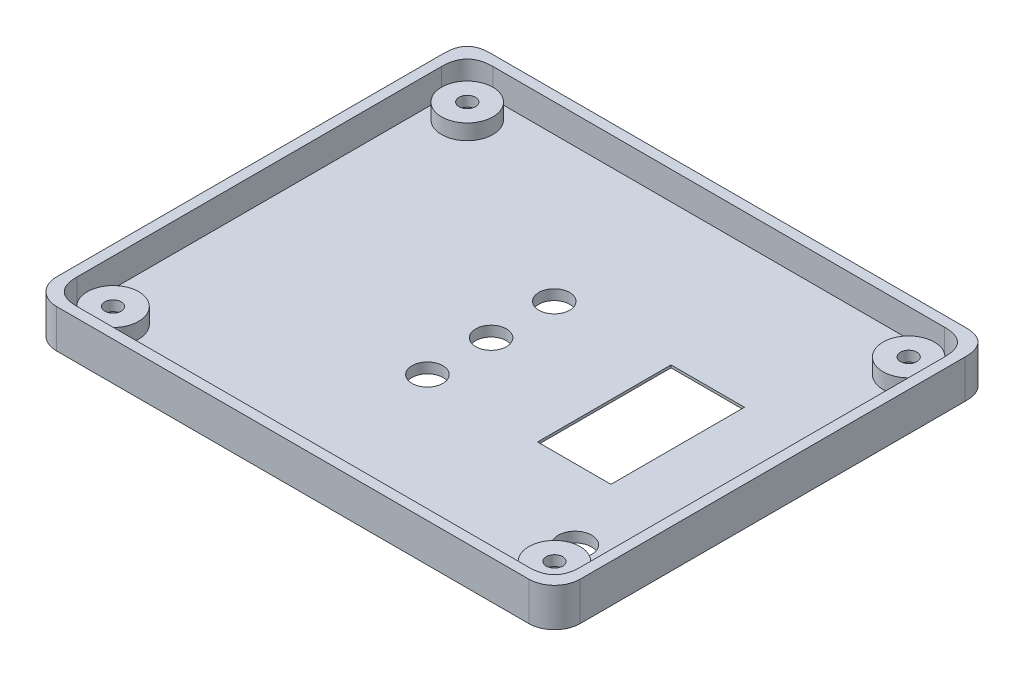
from build123d import *

# Parameters (mm, degrees)
SKETCH1_W           = 102
SKETCH1_H           = 85
BOSS_EXTRUDE1_DEPTH = 7.5
SKETCH2_W           = 98
SKETCH2_H           = 81
CUT_EXTRUDE1_DEPTH  = 5.5
SKETCH3_R           = 5
BOSS_EXTRUDE2_DEPTH = 4
SKETCH3_3_R         = 5
BOSS_EXTRUDE3_DEPTH = 5
SKETCH4_R           = 3
CUT_EXTRUDE3_DEPTH  = 3
SKETCH5_R           = 1.6
CUT_EXTRUDE4_DEPTH  = 7.5
SKETCH6_W           = 14.3
SKETCH6_H           = 26
CUT_EXTRUDE5_DEPTH  = 10
CHAMFER1_SIZE       = 1.5
CHAMFER2_SIZE       = 1.5
CHAMFER3_SIZE       = 1.5
CHAMFER4_SIZE       = 1.5
SKETCH7_R           = 3.25
CUT_EXTRUDE6_DEPTH  = 10
FILLET2_R           = 5
FILLET3_SIZE        = 5
FILLET4_R           = 5
FILLET5_SIZE        = 5
FILLET6_SIZE        = 5
FILLET7_SIZE        = 5
FILLET8_SIZE        = 5
FILLET9_SIZE        = 5
SKETCH8_R           = 3
CUT_EXTRUDE7_DEPTH  = 3


with BuildPart() as part:
    # Sketch1 → Boss-Extrude1 (new body)
    with BuildSketch(Plane(origin=(0, 0, 0), x_dir=(1, 0, 0), z_dir=(0, 1, 0))):
        Rectangle(SKETCH1_W, SKETCH1_H)
    extrude(amount=BOSS_EXTRUDE1_DEPTH)

    # Sketch2 → Cut-Extrude1 (cut)
    with BuildSketch(Plane(origin=(0, 7.5, 0), x_dir=(1, 0, 0), z_dir=(0, 1, 0))):
        Rectangle(SKETCH2_W, SKETCH2_H)
    extrude(amount=-CUT_EXTRUDE1_DEPTH, mode=Mode.SUBTRACT)



with BuildPart() as body_2:
    # Sketch3 → Boss-Extrude2 (new body)
    with BuildSketch(Plane(origin=(0, 0, 0), x_dir=(-1, 0, 0), z_dir=(0, -1, 0))):
        with Locations(Location((43, -34.5, 0), (0, 0, 90))):
            Circle(SKETCH3_R)
    extrude(amount=-BOSS_EXTRUDE2_DEPTH)


with BuildPart() as part_1:
    add(part.part)

    add(body_2.part)  # Boss-Extrude3 merges body 2
    # Sketch3<3> → Boss-Extrude3 (add)
    with BuildSketch(Plane(origin=(0, 0, 0), x_dir=(-1, 0, 0), z_dir=(0, -1, 0))):
        with Locations(Location((43, -34.5, 0), (0, 0, 90))):
            Circle(SKETCH3_3_R)
        with Locations(Location((-43, -34.5, 0), (0, 0, 90))):
            Circle(SKETCH3_3_R)
        with Locations(Location((43, 34.5, 0), (0, 0, 90))):
            Circle(SKETCH3_3_R)
        with Locations(Location((-43, 34.5, 0), (0, 0, 90))):
            Circle(SKETCH3_3_R)
    extrude(amount=-BOSS_EXTRUDE3_DEPTH)

    # Sketch4 → Cut-Extrude3 (cut)
    with BuildSketch(Plane.XZ):
        with Locations(Location((-43, 34.5, 0), (0, 0, 270))):
            Circle(SKETCH4_R)
        with Locations(Location((43, 34.5, 0), (0, 0, 270))):
            Circle(SKETCH4_R)
        with Locations(Location((-43, -34.5, 0), (0, 0, 270))):
            Circle(SKETCH4_R)
        with Locations(Location((43, -34.5, 0), (0, 0, 270))):
            Circle(SKETCH4_R)
    extrude(amount=-CUT_EXTRUDE3_DEPTH, mode=Mode.SUBTRACT)

    # Sketch5 → Cut-Extrude4 (cut)
    with BuildSketch(Plane.XZ):
        with Locations(Location((-43, 34.5, 0), (0, 0, 270))):
            Circle(SKETCH5_R)
        with Locations(Location((43, 34.5, 0), (0, 0, 270))):
            Circle(SKETCH5_R)
        with Locations(Location((43, -34.5, 0), (0, 0, 270))):
            Circle(SKETCH5_R)
        with Locations(Location((-43, -34.5, 0), (0, 0, 270))):
            Circle(SKETCH5_R)
    extrude(amount=-CUT_EXTRUDE4_DEPTH, mode=Mode.SUBTRACT)

    # Sketch6 → Cut-Extrude5 (cut)
    with BuildSketch(Plane.XZ):
        with Locations((25.35, 0)):
            Rectangle(SKETCH6_W, SKETCH6_H)
    extrude(amount=-CUT_EXTRUDE5_DEPTH, mode=Mode.SUBTRACT)

    # Chamfer1
    chamfer1_edges = [part_1.edges().sort_by_distance(p)[0] for p in [
        (25.35, 0, 13),
    ]]
    chamfer(chamfer1_edges, length=CHAMFER1_SIZE)

    # Chamfer2
    chamfer2_edges = [part_1.edges().sort_by_distance(p)[0] for p in [
        (18.2, 0, 0.75),
    ]]
    chamfer(chamfer2_edges, length=CHAMFER2_SIZE)

    # Chamfer3
    chamfer3_edges = [part_1.edges().sort_by_distance(p)[0] for p in [
        (32.5, 0, 0.75),
    ]]
    chamfer(chamfer3_edges, length=CHAMFER3_SIZE)

    # Chamfer4
    chamfer4_edges = [part_1.edges().sort_by_distance(p)[0] for p in [
        (25.35, 0, -13),
    ]]
    chamfer(chamfer4_edges, length=CHAMFER4_SIZE)

    # Sketch7 → Cut-Extrude6 (cut)
    with BuildSketch(Plane(origin=(0, 0, 0), x_dir=(-1, 0, 0), z_dir=(0, -1, 0))):
        with Locations(Location((-39.2, -26.7, 0), (0, 0, 90))):
            Circle(SKETCH7_R)
    extrude(amount=-CUT_EXTRUDE6_DEPTH, mode=Mode.SUBTRACT)

    # Fillet2
    fillet2_edges = [part_1.edges().sort_by_distance(p)[0] for p in [
        (51, 3.75, 42.5),
    ]]
    fillet(fillet2_edges, radius=FILLET2_R)

    # Fillet3
    # a fillet whose section is not a circle: 5 mm, written as the material it takes off along each edge
    with BuildSketch(Plane(origin=(51, -12.5, -42.5), x_dir=(0, 0, 1), z_dir=(0, 1, 0))) as fillet3_piece_1:
        with BuildLine():
            Bezier((FILLET3_SIZE, 0), (0, 0), (0, -FILLET3_SIZE), weights=[1, 1, 1])
            Line((0, -FILLET3_SIZE), (0, 0))
            Line((0, 0), (FILLET3_SIZE, 0))
        make_face()
    extrude(amount=32.5, mode=Mode.SUBTRACT)

    # Fillet4
    fillet4_edges = [part_1.edges().sort_by_distance(p)[0] for p in [
        (-51, 3.75, 42.5),
    ]]
    fillet(fillet4_edges, radius=FILLET4_R)

    # Fillet5
    # a fillet whose section is not a circle: 5 mm, written as the material it takes off along each edge
    with BuildSketch(Plane(origin=(-51, -12.5, -42.5), x_dir=(0, 0, 1), z_dir=(0, 1, 0))) as fillet5_piece_1:
        with BuildLine():
            add(Edge.make_bspline([(FILLET5_SIZE, 0), (FILLET5_SIZE * 0.831801948466, 0), (FILLET5_SIZE * 0.663603896932, 0), (FILLET5_SIZE * 0.292893218813, FILLET5_SIZE * 0.0716919198361), (FILLET5_SIZE * 0.0716919198361, FILLET5_SIZE * 0.292893218813), (0, FILLET5_SIZE * 0.663603896932), (0, FILLET5_SIZE * 0.831801948466), (0, FILLET5_SIZE)], knots=[0, 0, 0, 0, 0, 0, 0.5, 0.5, 1, 1, 1, 1, 1, 1], degree=5))
            Line((0, FILLET5_SIZE), (0, 0))
            Line((0, 0), (FILLET5_SIZE, 0))
        make_face()
    extrude(amount=32.5, mode=Mode.SUBTRACT)

    # Fillet6
    # a fillet whose section is not a circle: 5 mm, written as the material it adds along each edge
    with BuildSketch(Plane(origin=(49, 7.5, -40.5), x_dir=(-1, 0, 0), z_dir=(0, -1, 0))) as fillet6_piece_1:
        with BuildLine():
            Bezier((FILLET6_SIZE, 0), (0, 0), (0, -FILLET6_SIZE), weights=[1, 1, 1])
            Line((0, -FILLET6_SIZE), (0, 0))
            Line((0, 0), (FILLET6_SIZE, 0))
        make_face()
    extrude(amount=5.5)

    # Fillet7
    # a fillet whose section is not a circle: 5 mm, written as the material it adds along each edge
    with BuildSketch(Plane(origin=(49, 7.5, 40.5), x_dir=(0, 0, -1), z_dir=(0, -1, 0))) as fillet7_piece_1:
        with BuildLine():
            Bezier((FILLET7_SIZE, 0), (0, 0), (0, -FILLET7_SIZE), weights=[1, 1, 1])
            Line((0, -FILLET7_SIZE), (0, 0))
            Line((0, 0), (FILLET7_SIZE, 0))
        make_face()
    extrude(amount=5.5)

    # Fillet8
    # a fillet whose section is not a circle: 5 mm, written as the material it adds along each edge
    with BuildSketch(Plane(origin=(-49, 7.5, 40.5), x_dir=(1, 0, 0), z_dir=(0, -1, 0))) as fillet8_piece_1:
        with BuildLine():
            Bezier((FILLET8_SIZE, 0), (0, 0), (0, -FILLET8_SIZE), weights=[1, 1, 1])
            Line((0, -FILLET8_SIZE), (0, 0))
            Line((0, 0), (FILLET8_SIZE, 0))
        make_face()
    extrude(amount=5.5)

    # Fillet9
    # a fillet whose section is not a circle: 5 mm, written as the material it adds along each edge
    with BuildSketch(Plane(origin=(-49, 7.5, -40.5), x_dir=(0, 0, 1), z_dir=(0, -1, 0))) as fillet9_piece_1_section:
        with BuildLine():
            Bezier((FILLET9_SIZE, 0), (0, 0), (0, -FILLET9_SIZE), weights=[1, 1, 1])
            Line((0, -FILLET9_SIZE), (0, 0))
            Line((0, 0), (FILLET9_SIZE, 0))
        make_face()
    fillet9_piece_1 = extrude(amount=18, mode=Mode.PRIVATE)
    fillet9_piece_1 = split(fillet9_piece_1, bisect_by=Plane(origin=(-49, 0, -40.5), z_dir=(0, 1, 0)), keep=Keep.TOP, mode=Mode.PRIVATE)
    add(fillet9_piece_1)

    # Sketch8 → Cut-Extrude7 (cut)
    with BuildSketch(Plane.XZ):
        with Locations(Location((-3.9, -12.35, 0), (0, 0, 270))):
            Circle(SKETCH8_R)
        with Locations(Location((-3.9, -0.05, 0), (0, 0, 270))):
            Circle(SKETCH8_R)
        with Locations(Location((-3.9, 12.35, 0), (0, 0, 270))):
            Circle(SKETCH8_R)
    extrude(amount=-CUT_EXTRUDE7_DEPTH, mode=Mode.SUBTRACT)


solid = part_1.part
